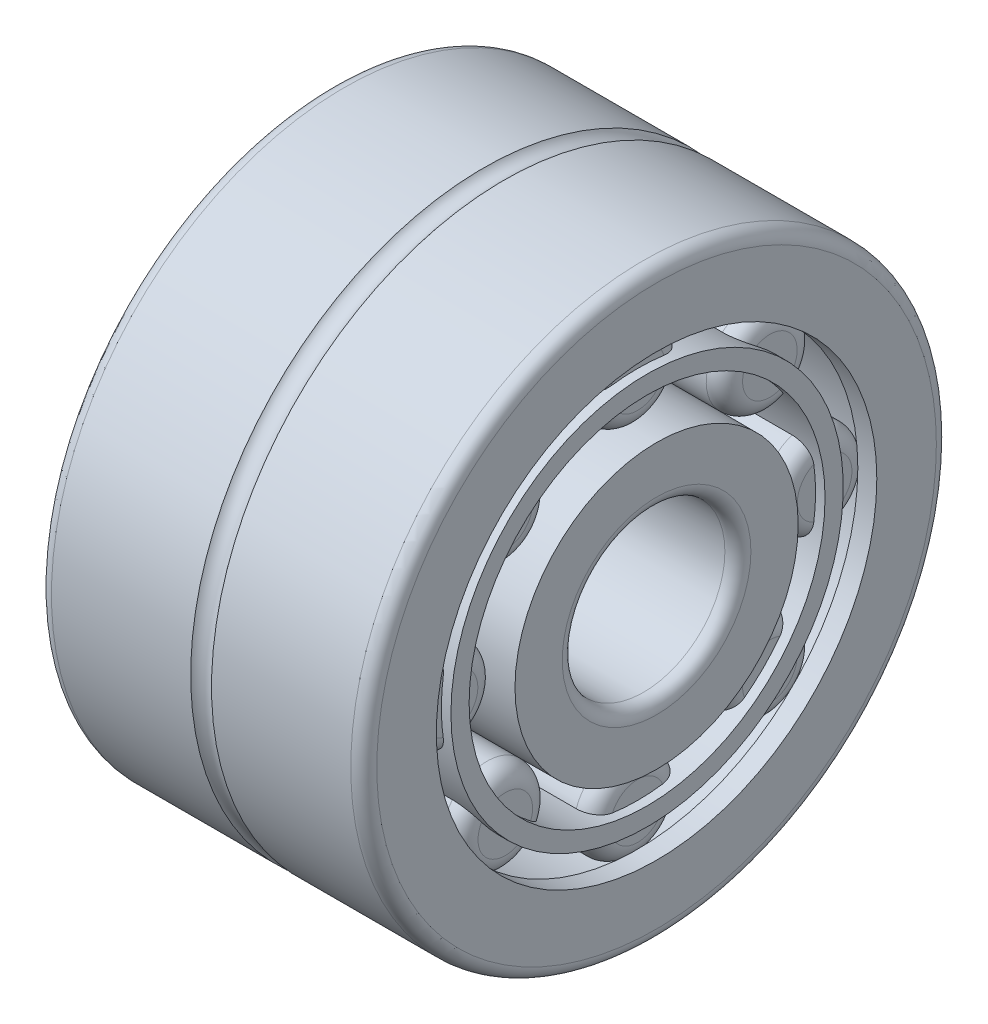
from build123d import *

# Parameters (mm, degrees)
CAGSPISKE_W           = 29.897916666
CAGSPISKE_H           = 1.775025
ROLLERSDETAILED_COUNT = 8
ROLLERSDETAILED_ANGLE = 315


with BuildPart() as part:
    # OutRacSke → OuterRace (revolve)
    with BuildSketch(Plane.XY):
        with BuildLine():
            Line((-14.022916667, 22.6933125), (-14.022916667, 21.4933125))
            Line((-14.022916667, 21.4933125), (-15.875, 21.4933125))
            Line((-15.875, 21.4933125), (-15.875, 27.305))
            ThreePointArc((-15.875, 27.305), (-15.503025612, 28.203025612), (-14.605, 28.575))
            Line((-14.605, 28.575), (-1.016, 28.575))
            ThreePointArc((-1.016, 28.575), (0, 28.067), (1.016, 28.575))
            Line((1.016, 28.575), (14.605, 28.575))
            ThreePointArc((14.605, 28.575), (15.503025612, 28.203025612), (15.875, 27.305))
            Line((15.875, 27.305), (15.875, 21.4933125))
            Line((15.875, 21.4933125), (14.022916667, 21.4933125))
            Line((14.022916667, 21.4933125), (14.022916667, 22.6933125))
            Line((14.022916667, 22.6933125), (-14.022916667, 22.6933125))
        make_face()
    revolve(axis=Axis((-7.9375, 0, 0), (1, 0, 0)))

    # RolDetSke → RollerDetailed (revolve)
    with BuildSketch(Plane.XY):
        with BuildLine():
            Line((-14.022916667, 20.9187875), (-14.022916667, 18.25625))
            Line((-14.022916667, 18.25625), (14.022916667, 18.25625))
            Line((14.022916667, 18.25625), (14.022916667, 20.9187875))
            ThreePointArc((14.022916667, 20.9187875), (13.503023881, 22.173919714), (12.247891667, 22.6938125))
            Line((12.247891667, 22.6938125), (-12.247891667, 22.6938125))
            ThreePointArc((-12.247891667, 22.6938125), (-13.503023881, 22.173919714), (-14.022916667, 20.9187875))
        make_face()
    rollerdetailed = revolve(axis=Axis((-28.575, 18.25625, 0), (1, 0, 0)))

    # InsRacSke → InnerRace (revolve)
    with BuildSketch(Plane.XY):
        with BuildLine():
            Line((-15.875, 13.8191875), (-15.875, 9.2075))
            ThreePointArc((-15.875, 9.2075), (-15.503025612, 8.309474388), (-14.605, 7.9375))
            Line((-14.605, 7.9375), (14.605, 7.9375))
            ThreePointArc((14.605, 7.9375), (15.503025612, 8.309474388), (15.875, 9.2075))
            Line((15.875, 9.2075), (15.875, 13.8191875))
            Line((15.875, 13.8191875), (-15.875, 13.8191875))
        make_face()
    revolve(axis=Axis((-7.9375, 0, 0), (1, 0, 0)))

    # CagSpiSke → CageSpine (revolve)
    with BuildSketch(Plane.XY):
        with Locations((0, 18.25625)):
            Rectangle(CAGSPISKE_W, CAGSPISKE_H)
    revolve(axis=Axis((-17.159454586, 0, 0), (1, 0, 0)))

    # RollersDetailed: RollerDetailed ×8 about axis
    rollersdetailed_axis = Axis((-50, 0, 0), (1, 0, 0))
    for i in range(1, ROLLERSDETAILED_COUNT):
        add(rollerdetailed.rotate(rollersdetailed_axis, i * ROLLERSDETAILED_ANGLE / (ROLLERSDETAILED_COUNT - 1)))


solid = part.part
